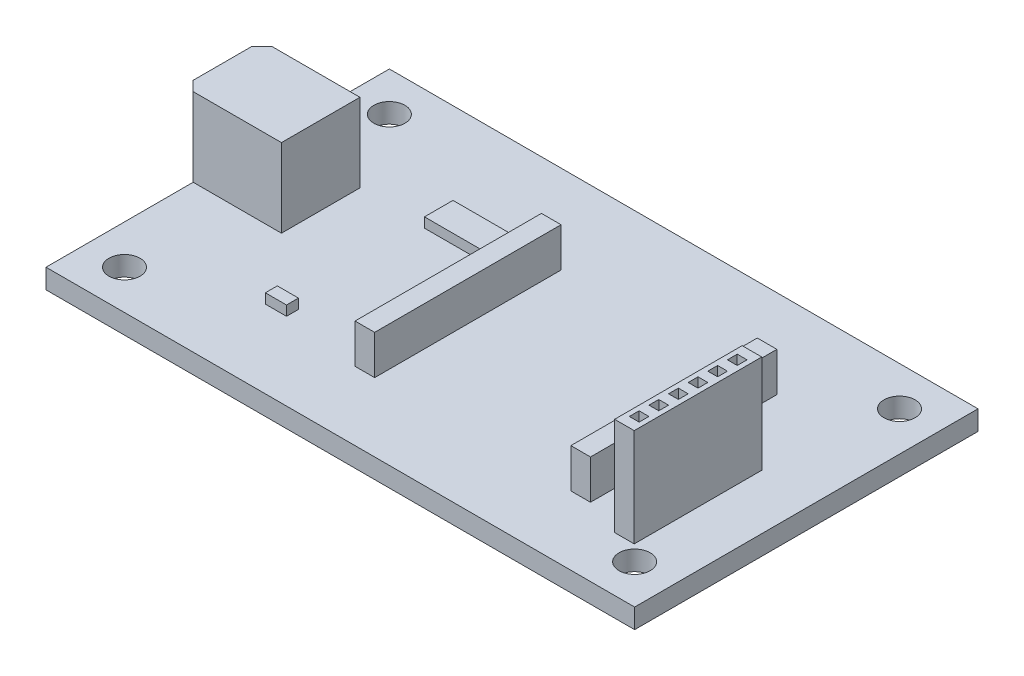
from build123d import *

# Parameters (mm, degrees)
SKETCH1_W           = 60
SKETCH1_H           = 35
SKETCH1_R           = 1.5875
BOSS_EXTRUDE1_DEPTH = 2
SKETCH2_W           = 2
SKETCH2_H           = 19
BOSS_EXTRUDE2_DEPTH = 4
SKETCH3_W           = 2
SKETCH3_H           = 13
BOSS_EXTRUDE3_DEPTH = 10
SKETCH4_W           = 5.906565556
SKETCH4_H           = 2.906405273
SKETCH4_W_2         = 2.156365203
SKETCH4_H_2         = 1.218815115
BOSS_EXTRUDE4_DEPTH = 1
BOSS_EXTRUDE5_DEPTH = 8
SKETCH7_W           = 3
SKETCH7_H           = 3
CUT_EXTRUDE1_DEPTH  = 9
SKETCH9_W           = 1
SKETCH9_H           = 1
CUT_EXTRUDE2_DEPTH  = 9


with BuildPart() as part:
    # Sketch1 → Boss-Extrude1 (new body)
    with BuildSketch(Plane(origin=(0, 0, 0), x_dir=(1, 0, 0), z_dir=(0, 1, 0))):
        with Locations((30, 17.5)):
            Rectangle(SKETCH1_W, SKETCH1_H)
        with Locations((4, 4)):
            Circle(SKETCH1_R, mode=Mode.SUBTRACT)
        with Locations((4, 31)):
            Circle(SKETCH1_R, mode=Mode.SUBTRACT)
        with Locations((56, 31)):
            Circle(SKETCH1_R, mode=Mode.SUBTRACT)
        with Locations((56, 4)):
            Circle(SKETCH1_R, mode=Mode.SUBTRACT)
    extrude(amount=BOSS_EXTRUDE1_DEPTH)

    # Sketch2 → Boss-Extrude2 (add)
    with BuildSketch(Plane(origin=(0, 2, 0), x_dir=(1, 0, 0), z_dir=(0, 1, 0))):
        with Locations((25.5, 16.5)):
            Rectangle(SKETCH2_W, SKETCH2_H)
        with Locations((47.5, 16.5)):
            Rectangle(SKETCH2_W, SKETCH2_H)
    extrude(amount=BOSS_EXTRUDE2_DEPTH)

    # Sketch3 → Boss-Extrude3 (add)
    with BuildSketch(Plane(origin=(0, 2, 0), x_dir=(1, 0, 0), z_dir=(0, 1, 0))):
        with Locations((53.405190381, 12.053258952)):
            Rectangle(SKETCH3_W, SKETCH3_H)
    extrude(amount=BOSS_EXTRUDE3_DEPTH)

    # Sketch4 → Boss-Extrude4 (add)
    with BuildSketch(Plane(origin=(0, 2, 0), x_dir=(1, 0, 0), z_dir=(0, 1, 0))):
        with Locations((18.796276446, 24.187990865)):
            Rectangle(SKETCH4_W, SKETCH4_H)
        with Locations((15.514851138, 8.530904392)):
            Rectangle(SKETCH4_W_2, SKETCH4_H_2)
    extrude(amount=BOSS_EXTRUDE4_DEPTH)

    # Sketch6 → Boss-Extrude5 (add)
    with BuildSketch(Plane(origin=(0, 2, 0), x_dir=(1, 0, 0), z_dir=(0, 1, 0))):
        Polygon((9, 23), (9, 15), (0, 15), (-1, 16), (-1, 22), (0, 23), align=None)
    extrude(amount=BOSS_EXTRUDE5_DEPTH)

    # Sketch7 → Cut-Extrude1 (cut)
    with BuildSketch(Plane.ZY.offset(1)):
        with Locations((-19, 7.75)):
            Rectangle(SKETCH7_W, SKETCH7_H)
        with Locations((-19, 4.25)):
            Rectangle(SKETCH7_W, SKETCH7_H)
    extrude(amount=-CUT_EXTRUDE1_DEPTH, mode=Mode.SUBTRACT)

    # Sketch9 → Cut-Extrude2 (cut)
    with BuildSketch(Plane(origin=(0, 12, 0), x_dir=(1, 0, 0), z_dir=(0, 1, 0))):
        with Locations((53.405190381, 13.053258952)):
            Rectangle(SKETCH9_W, SKETCH9_H)
        with Locations((53.405190381, 17.053258952)):
            Rectangle(SKETCH9_W, SKETCH9_H)
        with Locations((53.405190381, 15.053258952)):
            Rectangle(SKETCH9_W, SKETCH9_H)
        with Locations((53.405190381, 11.053258952)):
            Rectangle(SKETCH9_W, SKETCH9_H)
        with Locations((53.405190381, 9.053258952)):
            Rectangle(SKETCH9_W, SKETCH9_H)
        with Locations((53.405190381, 7.053258952)):
            Rectangle(SKETCH9_W, SKETCH9_H)
    extrude(amount=-CUT_EXTRUDE2_DEPTH, mode=Mode.SUBTRACT)


solid = part.part
